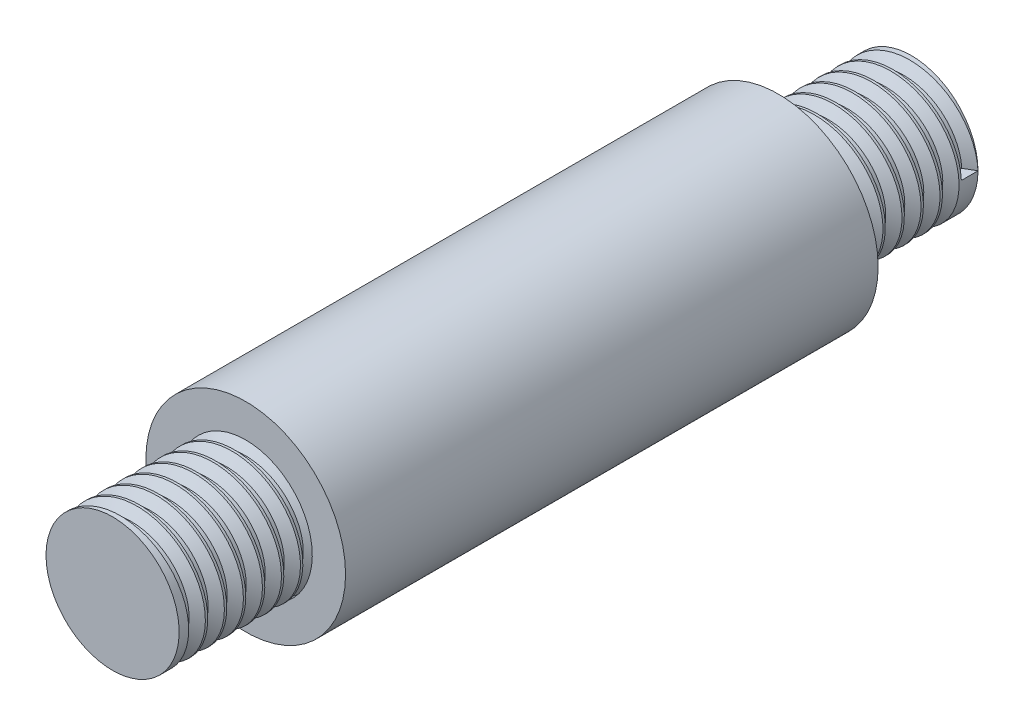
from build123d import *

# Parameters (mm, degrees)
SKETCH1_R             = 4.7625
BOSS_EXTRUDE1_DEPTH   = 25.4
SKETCH2_R             = 3.175
BOSS_EXTRUDE2_DEPTH   = 6.35
THREAD1_PITCH         = 0.907142857
THREAD2_PITCH         = 0.907142857
BOSS_EXTRUDE3_DEPTH   = 3.96875
SKETCH9_OUTSIDE_W     = 138.852
SKETCH9_OUTSIDE_H     = 136.888
SKETCH9_OUTSIDE_R     = 6.35
CUT_EXTRUDE1_DEPTH    = 55.058590986
CUT_EXTRUDE1_DRAFT    = -45
SKETCH17_R            = 3.175
CUT_EXTRUDE2_DEPTH    = 3.96875
THREAD3_PITCH         = 0.907142857
BODY_MOVE_COPY3_ANGLE = 180


with BuildPart() as part:
    # Sketch1 → Boss-Extrude1 (new body)
    with BuildSketch(Plane.XY):
        Circle(SKETCH1_R)
    extrude(amount=BOSS_EXTRUDE1_DEPTH)

    # Sketch2 → Boss-Extrude2 (add)
    with BuildSketch(Plane.XY.offset(25.4)):
        Circle(SKETCH2_R)
    boss_extrude2 = extrude(amount=BOSS_EXTRUDE2_DEPTH)

    # Mirror1: Boss-Extrude2 across plane
    add(boss_extrude2.mirror(Plane.XY.offset(12.7)))

    # Thread1: the profile of Thread Profile1 profile screwed along a right-hand helix of 7 turns, 8 arcs to a turn; built about Z, then put on its axis
    thread1_z = Axis((0, 0, 0), (0, 0, 1))
    thread1_corners = [(3.1753, 0, -0.000173205), (3.1753, 0, 0.793923203), (2.683994528, 0, 0.510267856), (2.683994528, 0, 0.283482142)]
    with BuildLine(mode=Mode.PRIVATE) as thread1_profile:
        Line(thread1_corners[0], thread1_corners[1])
        Line(thread1_corners[1], thread1_corners[2])
        Line(thread1_corners[2], thread1_corners[3])
        Line(thread1_corners[3], thread1_corners[0])
    thread1_cap = Face(thread1_profile.wire())
    thread1_turn_angles = [0, 22.5, 45, 67.5, 90, 112.5, 135, 157.5, 180, 202.5, 225, 247.5, 270, 292.5, 315, 337.5, 360]
    thread1_turn_weights = [1, 0.9238795325112867, 1, 0.9238795325112867, 1, 0.9238795325112867, 1, 0.9238795325112867, 1, 0.9238795325112867, 1, 0.9238795325112867, 1, 0.9238795325112867, 1, 0.9238795325112867, 1]
    thread1_turn_rails = [Edge.make_bspline([Vector(p[0], p[1], 0).rotate(thread1_z, thread1_turn_angles[k]) / thread1_turn_weights[k] + Vector(0, 0, p[2] + THREAD1_PITCH * thread1_turn_angles[k] / 360) for k in range(17)], [0, 0, 0, 1, 1, 2, 2, 3, 3, 4, 4, 5, 5, 6, 6, 7, 7, 8, 8, 8], 2, thread1_turn_weights) for p in thread1_corners]
    thread1_turn_sides = [Face.make_surface_from_curves(thread1_turn_rails[p[0]], thread1_turn_rails[p[1]]) for p in [(0, 1), (1, 2), (2, 3), (3, 0)]]
    thread1 = Plane(origin=(0, 0, 31.75), x_dir=(-1, 0, 0), z_dir=(0, 0, -1)) * Solid(Shell([*[p.moved(Location((0, 0, THREAD1_PITCH * i))) for i in range(7) for p in thread1_turn_sides], thread1_cap, thread1_cap.rotate(thread1_z, 2520).moved(Location((0, 0, THREAD1_PITCH * 2520 / 360)))]))
    add(thread1, mode=Mode.SUBTRACT)

    # Thread2: the profile of Thread Profile2 profile screwed along a right-hand helix of 7 turns, 8 arcs to a turn; built about Z, then put on its axis
    thread2_z = Axis((0, 0, 0), (0, 0, 1))
    thread2_corners = [(3.1753, 0, -0.000173205), (3.1753, 0, 0.793923203), (2.683994528, 0, 0.510267856), (2.683994528, 0, 0.283482142)]
    with BuildLine(mode=Mode.PRIVATE) as thread2_profile:
        Line(thread2_corners[0], thread2_corners[1])
        Line(thread2_corners[1], thread2_corners[2])
        Line(thread2_corners[2], thread2_corners[3])
        Line(thread2_corners[3], thread2_corners[0])
    thread2_cap = Face(thread2_profile.wire())
    thread2_turn_angles = [0, 22.5, 45, 67.5, 90, 112.5, 135, 157.5, 180, 202.5, 225, 247.5, 270, 292.5, 315, 337.5, 360]
    thread2_turn_weights = [1, 0.9238795325112867, 1, 0.9238795325112867, 1, 0.9238795325112867, 1, 0.9238795325112867, 1, 0.9238795325112867, 1, 0.9238795325112867, 1, 0.9238795325112867, 1, 0.9238795325112867, 1]
    thread2_turn_rails = [Edge.make_bspline([Vector(p[0], p[1], 0).rotate(thread2_z, thread2_turn_angles[k]) / thread2_turn_weights[k] + Vector(0, 0, p[2] + THREAD2_PITCH * thread2_turn_angles[k] / 360) for k in range(17)], [0, 0, 0, 1, 1, 2, 2, 3, 3, 4, 4, 5, 5, 6, 6, 7, 7, 8, 8, 8], 2, thread2_turn_weights) for p in thread2_corners]
    thread2_turn_sides = [Face.make_surface_from_curves(thread2_turn_rails[p[0]], thread2_turn_rails[p[1]]) for p in [(0, 1), (1, 2), (2, 3), (3, 0)]]
    thread2 = Plane(origin=(0, 0, -6.35), x_dir=(1, 0, 0), z_dir=(0, 0, 1)) * Solid(Shell([*[p.moved(Location((0, 0, THREAD2_PITCH * i))) for i in range(7) for p in thread2_turn_sides], thread2_cap, thread2_cap.rotate(thread2_z, 2520).moved(Location((0, 0, THREAD2_PITCH * 2520 / 360)))]))
    add(thread2, mode=Mode.SUBTRACT)


with BuildPart() as body_2:
    # Sketch8 → Boss-Extrude3 (new body)
    with BuildSketch(Plane.XY.offset(-25.4)):
        Polygon((7.332348419, 0), (3.666174209, 6.35), (-3.666174209, 6.35), (-7.332348419, 0), (-3.666174209, -6.35), (3.666174209, -6.35), align=None)
    extrude(amount=BOSS_EXTRUDE3_DEPTH)


with BuildPart() as cut_extrude1_tool:
    # Sketch9 outside → Cut-Extrude1 (with draft: the straight prism first)
    with BuildSketch(Plane.XY.offset(-21.43125)):
        Rectangle(SKETCH9_OUTSIDE_W, SKETCH9_OUTSIDE_H)
        Circle(SKETCH9_OUTSIDE_R, mode=Mode.SUBTRACT)
    extrude(amount=-CUT_EXTRUDE1_DEPTH)
    # Cut-Extrude1: the draft: its side faces are tilted about the plane it starts from
    cut_extrude1_sides = [cut_extrude1_tool.faces().sort_by_distance(p)[0] for p in [
        (0, -68.444, -48.960545493),
        (69.426, 0, -48.960545493),
        (0, 68.444, -48.960545493),
        (-69.426, 0, -48.960545493),
        (-6.35, 0, -48.960545493),
    ]]
    draft(cut_extrude1_sides, Plane.XY.offset(-21.43125), CUT_EXTRUDE1_DRAFT)


with BuildPart() as body_2_1:
    add(body_2.part)

    # Cut-Extrude1: cut by cut_extrude1_tool
    add(cut_extrude1_tool.part, mode=Mode.SUBTRACT)

    # Sketch17 → Cut-Extrude2 (cut)
    with BuildSketch(Plane(origin=(0, 0, -25.4), x_dir=(-1, 0, 0), z_dir=(0, 0, -1))):
        Circle(SKETCH17_R)
    extrude(amount=-CUT_EXTRUDE2_DEPTH, mode=Mode.SUBTRACT)

    # Thread3: the profile of Thread Profile3 profile screwed along a right-hand helix of 4.375 turns, 8 arcs to a turn; built about Z, then put on its axis
    thread3_z = Axis((0, 0, 0), (0, 0, 1))
    thread3_corners = [(3.1753, 0, -0.000173205), (3.1753, 0, 0.793923203), (2.683994528, 0, 0.510267856), (2.683994528, 0, 0.283482142)]
    with BuildLine(mode=Mode.PRIVATE) as thread3_profile:
        Line(thread3_corners[0], thread3_corners[1])
        Line(thread3_corners[1], thread3_corners[2])
        Line(thread3_corners[2], thread3_corners[3])
        Line(thread3_corners[3], thread3_corners[0])
    thread3_cap = Face(thread3_profile.wire())
    thread3_turn_angles = [0, 22.5, 45, 67.5, 90, 112.5, 135, 157.5, 180, 202.5, 225, 247.5, 270, 292.5, 315, 337.5, 360]
    thread3_turn_weights = [1, 0.9238795325112867, 1, 0.9238795325112867, 1, 0.9238795325112867, 1, 0.9238795325112867, 1, 0.9238795325112867, 1, 0.9238795325112867, 1, 0.9238795325112867, 1, 0.9238795325112867, 1]
    thread3_turn_rails = [Edge.make_bspline([Vector(p[0], p[1], 0).rotate(thread3_z, thread3_turn_angles[k]) / thread3_turn_weights[k] + Vector(0, 0, p[2] + THREAD3_PITCH * thread3_turn_angles[k] / 360) for k in range(17)], [0, 0, 0, 1, 1, 2, 2, 3, 3, 4, 4, 5, 5, 6, 6, 7, 7, 8, 8, 8], 2, thread3_turn_weights) for p in thread3_corners]
    thread3_turn_sides = [Face.make_surface_from_curves(thread3_turn_rails[p[0]], thread3_turn_rails[p[1]]) for p in [(0, 1), (1, 2), (2, 3), (3, 0)]]
    thread3_last_angles = [1440, 1462.5, 1485, 1507.5, 1530, 1552.5, 1575]
    thread3_last_weights = [1, 0.9238795325112867, 1, 0.9238795325112867, 1, 0.923879532511286, 1]
    thread3_last_rails = [Edge.make_bspline([Vector(p[0], p[1], 0).rotate(thread3_z, thread3_last_angles[k]) / thread3_last_weights[k] + Vector(0, 0, p[2] + THREAD3_PITCH * thread3_last_angles[k] / 360) for k in range(7)], [0, 0, 0, 1, 1, 2, 2, 3, 3, 3], 2, thread3_last_weights) for p in thread3_corners]
    thread3_last_sides = [Face.make_surface_from_curves(thread3_last_rails[p[0]], thread3_last_rails[p[1]]) for p in [(0, 1), (1, 2), (2, 3), (3, 0)]]
    thread3 = Plane(origin=(0, 0, -25.4), x_dir=(1, 0, 0), z_dir=(0, 0, 1)) * Solid(Shell([*[p.moved(Location((0, 0, THREAD3_PITCH * i))) for i in range(4) for p in thread3_turn_sides], *thread3_last_sides, thread3_cap, thread3_cap.rotate(thread3_z, 1575).moved(Location((0, 0, THREAD3_PITCH * 1575 / 360)))]))
    add(thread3)


with BuildPart() as body_3:
    # Body-Move/Copy1: copy of body 2
    add(body_2_1.part.moved(Location((40.078606843, 0, 0))))


with BuildPart() as body_2_2:
    # Body-Move/Copy3: moved
    add(body_2_1.part.moved(Location((0, 0, 0))).rotate(Axis((19.881090789, 1.773538754, -23.016750001), (-0.0888544673809535, 0.9960446192949627, -1.0199873248589058e-15)), BODY_MOVE_COPY3_ANGLE))


with BuildPart() as body_3_1:
    # Body-Move/Copy3: moved
    add(body_3.part.moved(Location((0, 0, 0))).rotate(Axis((19.881090789, 1.773538754, -23.016750001), (-0.0888544673809535, 0.9960446192949627, -1.0199873248589058e-15)), BODY_MOVE_COPY3_ANGLE))


solid = part.part
